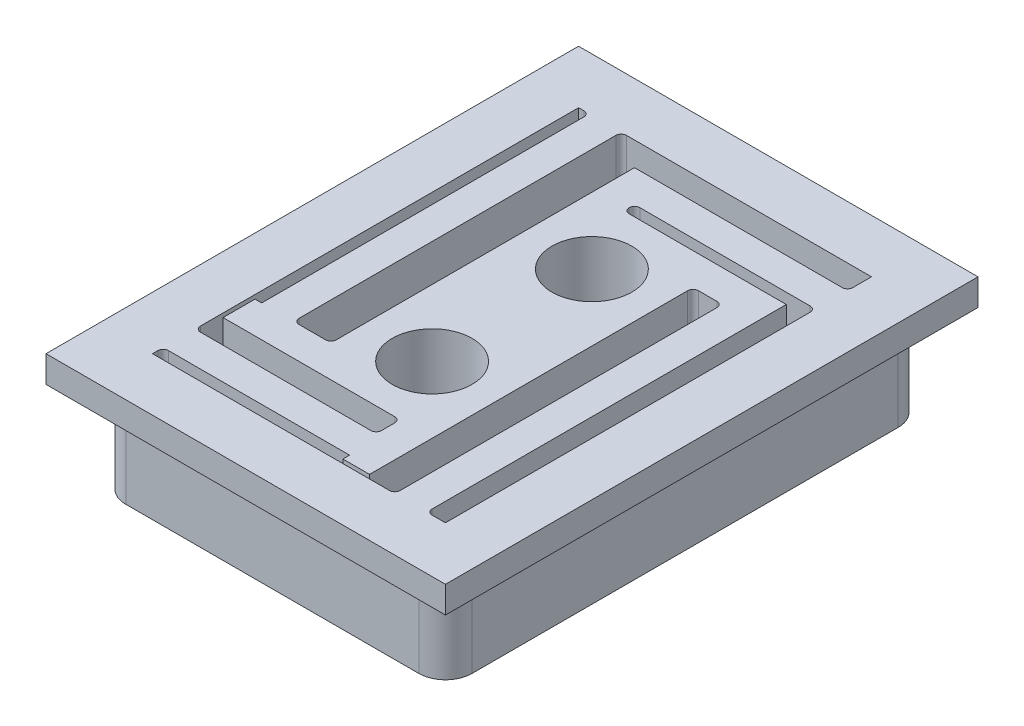
from build123d import *

# Parameters (mm, degrees)
SKETCH1_W           = 13
SKETCH1_H           = 18
BOSS_EXTRUDE1_DEPTH = 3.4
SKETCH2_W           = 15
SKETCH2_H           = 20
BOSS_EXTRUDE2_DEPTH = 1
SKETCH3_R           = 1.5
CUT_EXTRUDE1_DEPTH  = 14.251792332
FILLET1_R           = 0.2
FILLET2_R           = 1


with BuildPart() as part:
    # Sketch1 → Boss-Extrude1 (new body)
    with BuildSketch(Plane(origin=(0, 0, 0), x_dir=(1, 0, 0), z_dir=(0, 1, 0))):
        Rectangle(SKETCH1_W, SKETCH1_H)
    extrude(amount=BOSS_EXTRUDE1_DEPTH)

    # Sketch2 → Boss-Extrude2 (add)
    with BuildSketch(Plane(origin=(0, 3.4, 0), x_dir=(1, 0, 0), z_dir=(0, 1, 0))):
        Rectangle(SKETCH2_W, SKETCH2_H)
    extrude(amount=BOSS_EXTRUDE2_DEPTH)

    # Sketch3 → Cut-Extrude1 (cut, through all)
    with BuildSketch(Plane.XZ):
        with Locations(Location((0, 3, 0), (0, 0, 270))):
            Circle(SKETCH3_R)
        with Locations(Location((0, -3, 0), (0, 0, 270))):
            Circle(SKETCH3_R)
        Polygon((4.8, -5.5), (-1.3, -5.5), (-1.3, -5.9), (5.5, -5.9), (5.5, 8), (4.8, 8), align=None)
        Polygon((2.5, 7.85), (2.5, -4.3), (3.6, -4.3), (3.6, 8), (-5.5, 8), (-5.5, 7.6), (1.5, 7.6), (1.5, 7.85), align=None)
        Polygon((-2.5, -7.1), (-2.5, 4.3), (-3.9, 4.3), (-3.9, -8), (5.5, -8), (5.5, -7.1), align=None)
        Polygon((-5.35, 5.5), (1.3, 5.5), (1.3, 6.4), (-5.5, 6.4), (-5.5, -8), (-5.1, -8), (-5.1, 4.3), (-5.35, 4.3), align=None)
    extrude(amount=-CUT_EXTRUDE1_DEPTH, mode=Mode.SUBTRACT)

    # Fillet1
    fillet1_edges = [part.edges().sort_by_distance(p)[0] for p in [
        (-5.1, 2.2, -8),
        (-3.9, 2.2, -8),
        (-5.5, 2.2, 6.4),
        (-5.5, 2.2, 7.6),
        (4.8, 2.2, 8),
        (3.6, 2.2, 8),
        (-3.9, 2.2, 4.3),
        (-2.5, 2.2, 4.3),
        (1.3, 2.2, 5.5),
        (1.3, 2.2, 6.4),
        (5.5, 2.2, -7.1),
        (5.5, 2.2, -5.9),
        (-1.3, 2.2, -5.9),
        (-1.3, 2.2, -5.5),
        (3.6, 2.2, -4.3),
        (2.5, 2.2, -4.3),
    ]]
    fillet(fillet1_edges, radius=FILLET1_R - 0.0001)  # a hair under: the kernel refuses the full size

    # Fillet2
    fillet2_edges = [part.edges().sort_by_distance(p)[0] for p in [
        (6.5, 1.7, 9),
        (-6.5, 1.7, 9),
        (-6.5, 1.7, -9),
        (6.5, 1.7, -9),
    ]]
    fillet(fillet2_edges, radius=FILLET2_R)


solid = part.part
